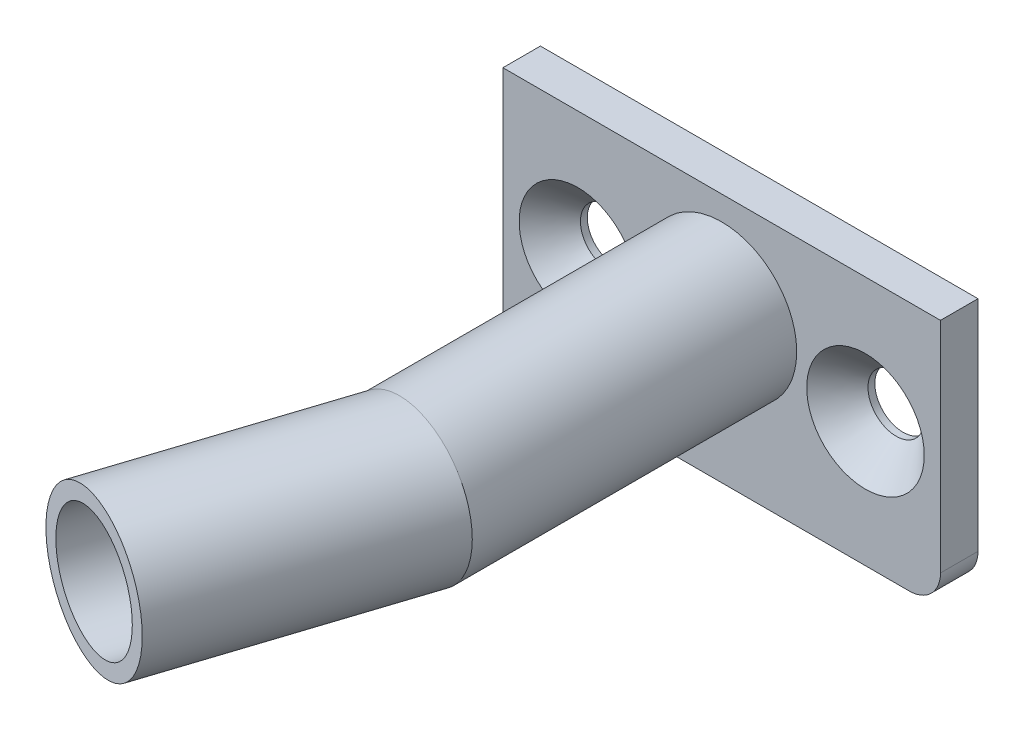
from build123d import *

# Parameters (mm, degrees)
SKETCH7_W                                      = 35
SKETCH7_H                                      = 20
BOSS_EXTRUDE4_DEPTH                            = 3
FILLET1_R                                      = 2.5
SKETCH8_R                                      = 6
BOSS_EXTRUDE5_DEPTH                            = 20
SKETCH10_R                                     = 6
BOSS_EXTRUDE6_START                            = 15
SKETCH11_R                                     = 6
SKETCH11_R_2                                   = 4.7625
BOSS_EXTRUDE6_DEPTH                            = 15
CSK_FOR_M4_FLAT_HEAD_MACHINE_SCREW1_AT_2_COUNT = 2
CSK_FOR_M4_FLAT_HEAD_MACHINE_SCREW1_AT_2_PITCH = 23


with BuildPart() as part:
    # Sketch7 → Boss-Extrude4 (new body)
    with BuildSketch(Plane.XY):
        Rectangle(SKETCH7_W, SKETCH7_H)
    extrude(amount=BOSS_EXTRUDE4_DEPTH)

    # Fillet1
    fillet1_edges = [part.edges().sort_by_distance(p)[0] for p in [
        (17.5, -10, 1.5),
        (-17.5, -10, 1.5),
    ]]
    fillet(fillet1_edges, radius=FILLET1_R)

    # Sketch8 → Boss-Extrude5 (add)
    with BuildSketch(Plane.XY.offset(3)):
        with Locations((0, 2.073)):
            Circle(SKETCH8_R)
    extrude(amount=BOSS_EXTRUDE5_DEPTH)

    # Sweep3: sweep along a path in Sketch9
    with BuildLine(Plane(origin=(0, 2.073, 0), x_dir=(1, 0, 0), z_dir=(0, 1, 0))) as sweep3_path:
        Line((0, -23), (0, -28))
        Line((0, -28), (-1.545084972, -32.755282581))
    # Sketch10 → Sweep3 (sweep)
    with BuildSketch(Plane.XY.offset(23)):
        with Locations((0, 2.073)):
            Circle(SKETCH10_R)
    sweep(path=sweep3_path.line, transition=Transition.RIGHT)

    # Sketch11 → Boss-Extrude6 (add)
    with BuildSketch(Plane(origin=(-9.774078504, 0, 30.081520503), x_dir=(0.9510565162951534, 0, 0.3090169943749484), z_dir=(-0.3090169943749484, 0, 0.9510565162951534)).offset(BOSS_EXTRUDE6_START)):
        with Locations((8.652475842, 2.073)):
            Circle(SKETCH11_R)
        with Locations((8.652475842, 2.073)):
            Circle(SKETCH11_R_2, mode=Mode.SUBTRACT)
    extrude(amount=-BOSS_EXTRUDE6_DEPTH)

    # Sketch13 → CSK for M4 Flat Head Machine Screw1 (revolve, cut)
    with BuildSketch(Plane(origin=(-11.5, 0, 3), x_dir=(0, -1, 0), z_dir=(1, 0, 0))):
        Polygon((0, 0), (0, 3), (2.25, 3), (2.25, 2.45), (4.7, 0), align=None)
    csk_for_m4_flat_head_machine_screw1 = revolve(axis=Axis((-11.5, 0, 9.35), (0, 0, -1)), mode=Mode.SUBTRACT)

    # CSK for M4 Flat Head Machine Screw1 at 2: CSK for M4 Flat Head Machine Screw1 ×2
    with Locations(*[(i * CSK_FOR_M4_FLAT_HEAD_MACHINE_SCREW1_AT_2_PITCH, 0, 0) for i in range(1, CSK_FOR_M4_FLAT_HEAD_MACHINE_SCREW1_AT_2_COUNT)]):
        add(csk_for_m4_flat_head_machine_screw1, mode=Mode.SUBTRACT)


solid = part.part
